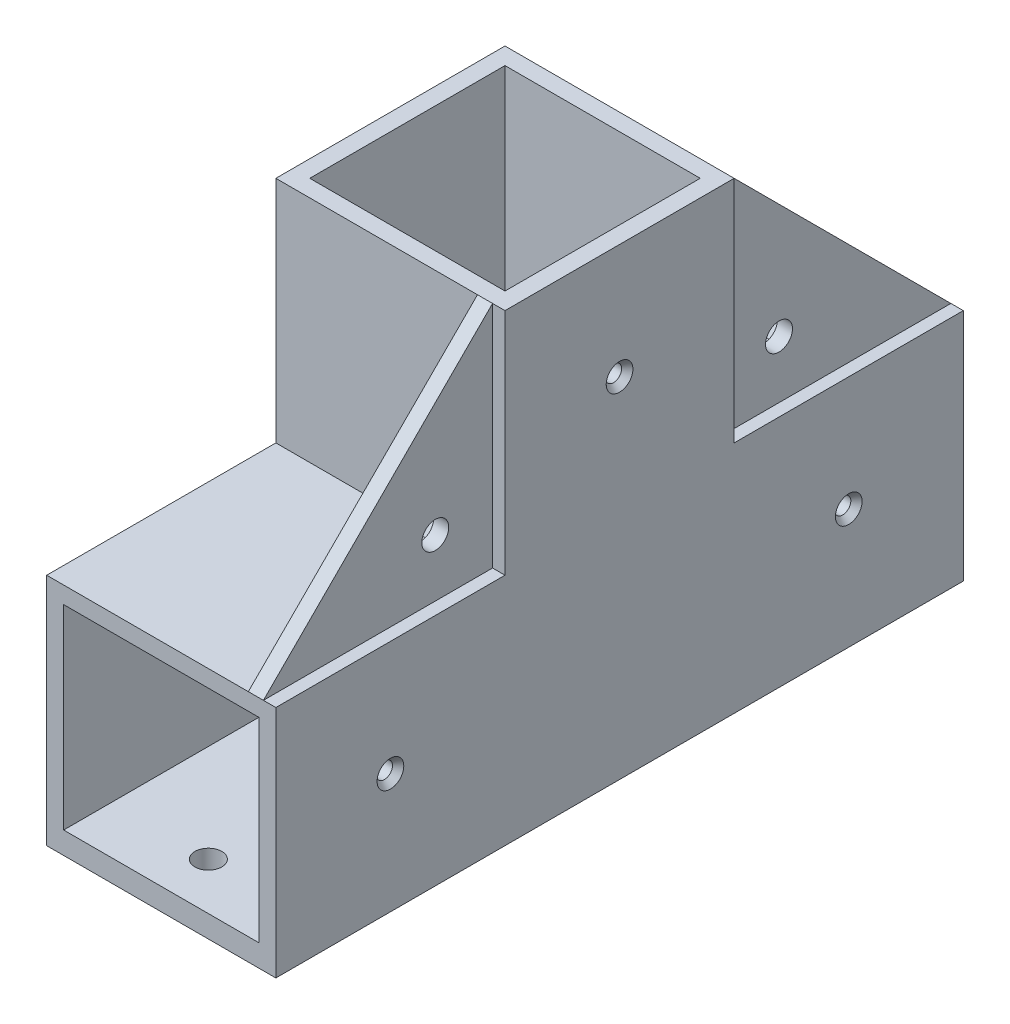
from build123d import *
from build123d.topology import SkipClean

# Parameters (mm, degrees)
ESQUISSE1_W                                       = 60.8
ESQUISSE1_H                                       = 121.6
BOSS_EXTRU_1_DEPTH                                = 91.2
ESQUISSE2_W                                       = 60.8
ESQUISSE2_H                                       = 60.8
ENL_V_MAT_EXTRU_1_DEPTH                           = 126.342411019
ESQUISSE3_W                                       = 51.8
ESQUISSE3_H                                       = 51.8
ENL_V_MAT_EXTRU_2_DEPTH                           = 60.8
BOSS_EXTRU_3_DEPTH                                = 4
ESQUISSE6_W                                       = 51.8
ESQUISSE6_H                                       = 51.8
ENL_V_MAT_EXTRU_3_DEPTH                           = 60.8
D_GAGEMENT_1_43_D                                 = 7.14248
FRAISAGE_POUR_VIS_T_TE_FRAIS_E_BOMB_E_D           = 4.3053
FRAISAGE_POUR_VIS_T_TE_FRAIS_E_BOMB_E_DEPTH       = 4.5
FRAISAGE_POUR_VIS_T_TE_FRAIS_E_BOMB_E_CSINK_D     = 7.0866
FRAISAGE_POUR_VIS_T_TE_FRAIS_E_BOMB_E_CSINK_ANGLE = 82
D_GAGEMENT_1_42_D                                 = 7.14248
D_GAGEMENT_1_42_DEPTH                             = 20
BOSS_EXTRU_5_DEPTH                                = 4
CHANFREIN1_SIZE                                   = 4
ESQUISSE26_W                                      = 60.8
ESQUISSE26_H                                      = 182.4
ESQUISSE26_R                                      = 3.57124
BOSS_EXTRU_7_DEPTH                                = 1.35


with BuildPart() as part:
    # Esquisse1 → Boss.-Extru.1 (new, symmetric)
    with BuildSketch(Plane.XY):
        Rectangle(ESQUISSE1_W, ESQUISSE1_H)
    extrude(amount=BOSS_EXTRU_1_DEPTH, both=True)

    # Esquisse2 → Enlèv. mat.-Extru.1 (cut, through all)
    with BuildSketch(Plane.ZY.offset(30.4)):
        with Locations((-60.8, 30.4)):
            Rectangle(ESQUISSE2_W, ESQUISSE2_H)
    enl_v_mat_extru_1 = extrude(amount=-ENL_V_MAT_EXTRU_1_DEPTH, mode=Mode.SUBTRACT)

    # Esquisse3 → Enlèv. mat.-Extru.2 (cut)
    with BuildSketch(Plane(origin=(0, 0, -91.2), x_dir=(-1, 0, 0), z_dir=(0, 0, -1))):
        with Locations((0, -30.4)):
            Rectangle(ESQUISSE3_W, ESQUISSE3_H)
    enl_v_mat_extru_2 = extrude(amount=-ENL_V_MAT_EXTRU_2_DEPTH, mode=Mode.SUBTRACT)

    # Symétrie2: Enlèv. mat.-Extru.1, Enlèv. mat.-Extru.2 across plane
    add(enl_v_mat_extru_1.mirror(Plane.XY), mode=Mode.SUBTRACT)
    add(enl_v_mat_extru_2.mirror(Plane.XY), mode=Mode.SUBTRACT)

    # Esquisse10 → Boss.-Extru.3 (add)
    with BuildSketch(Plane(origin=(27.1, 0, 0), x_dir=(0, 0, -1), z_dir=(1, 0, 0))):
        Polygon((30.4, 60.8), (30.4, 0), (91.2, 0), align=None)
        Polygon((-30.4, 60.8), (-91.2, 0), (-30.4, 0), align=None)
    extrude(amount=-BOSS_EXTRU_3_DEPTH)

    # Esquisse6 → Enlèv. mat.-Extru.3 (cut)
    with BuildSketch(Plane(origin=(0, 60.8, 0), x_dir=(1, 0, 0), z_dir=(0, 1, 0))):
        Rectangle(ESQUISSE6_W, ESQUISSE6_H)
    extrude(amount=-ENL_V_MAT_EXTRU_3_DEPTH, mode=Mode.SUBTRACT)

    # Dégagement 1/43 (through all)
    with Locations(Plane(origin=(27.1, 0, 0), x_dir=(0, 0, -1), z_dir=(1, 0, 0))):
        with Locations((45.6, 15.2), (-45.6, 15.2)):
            Hole(D_GAGEMENT_1_43_D / 2)

    # Fraisage pour vis _ t_te frais_e bomb_e
    with Locations(Plane(origin=(30.4, 0, 0), x_dir=(0, 0, -1), z_dir=(1, 0, 0))):
        with Locations((-60.8, -30.4), (0, 30.4), (60.8, -30.4)):
            CounterSinkHole(FRAISAGE_POUR_VIS_T_TE_FRAIS_E_BOMB_E_D / 2, FRAISAGE_POUR_VIS_T_TE_FRAIS_E_BOMB_E_CSINK_D / 2, depth=FRAISAGE_POUR_VIS_T_TE_FRAIS_E_BOMB_E_DEPTH, counter_sink_angle=FRAISAGE_POUR_VIS_T_TE_FRAIS_E_BOMB_E_CSINK_ANGLE)

    # Dégagement 1/42
    with Locations(Plane(origin=(0, -60.8, 0), x_dir=(-1, 0, 0), z_dir=(0, -1, 0))):
        with Locations((0, 78.7), (0, -78.7)):
            Hole(D_GAGEMENT_1_42_D / 2, depth=D_GAGEMENT_1_42_DEPTH)

    # Esquisse23 → Boss.-Extru.5 (add)
    # profile 1 of 2: a face of its own
    with BuildSketch(Plane.ZY.offset(-23.1)):
        Polygon((-41.197704197, 22.825), (-50.002295803, 22.825), (-54.404591605, 15.2), (-50.002295803, 7.575), (-41.197704197, 7.575), (-36.795408395, 15.2), align=None)
        Polygon((-40.25951001, 15.2), (-42.929755005, 19.825), (-48.270244995, 19.825), (-50.94048999, 15.2), (-48.270244995, 10.575), (-42.929755005, 10.575), align=None, mode=Mode.SUBTRACT)
    # profile 2 of 2: a face of its own
    with BuildSketch(Plane.ZY.offset(-23.1)):
        Polygon((54.404591605, 15.2), (50.002295803, 22.825), (41.197704197, 22.825), (36.795408395, 15.2), (41.197704197, 7.575), (50.002295803, 7.575), align=None)
        Polygon((50.94048999, 15.2), (48.270244995, 19.825), (42.929755005, 19.825), (40.25951001, 15.2), (42.929755005, 10.575), (48.270244995, 10.575), align=None, mode=Mode.SUBTRACT)
    extrude(amount=BOSS_EXTRU_5_DEPTH)

    # Chanfrein1
    chanfrein1_edges = [part.edges().sort_by_distance(p)[0] for p in [
        (23.1, 19.0125, 38.996556296),
        (23.1, 11.3875, 38.996556296),
        (23.1, 7.575, 45.6),
        (23.1, 11.3875, 52.203443704),
        (23.1, 19.0125, 52.203443704),
        (23.1, 22.825, 45.6),
        (23.1, 11.3875, -38.996556296),
        (23.1, 19.0125, -38.996556296),
        (23.1, 7.575, -45.6),
        (23.1, 11.3875, -52.203443704),
        (23.1, 22.825, -45.6),
        (23.1, 19.0125, -52.203443704),
    ]]
    chamfer(chanfrein1_edges, length=CHANFREIN1_SIZE - 0.0001)  # a hair under: the kernel refuses the full size

    # Esquisse26 → Boss.-Extru.7 (add)
    with SkipClean():  # the faces are left unmerged after this step: merging them gives an invalid solid
        with BuildSketch(Plane.XZ.offset(60.8)):
            Rectangle(ESQUISSE26_W, ESQUISSE26_H)
            with Locations(Location((0, 78.7, 0), (0, 0, 270))):
                Circle(ESQUISSE26_R, mode=Mode.SUBTRACT)
            with Locations(Location((0, -78.7, 0), (0, 0, 270))):
                Circle(ESQUISSE26_R, mode=Mode.SUBTRACT)
        extrude(amount=BOSS_EXTRU_7_DEPTH)
    add(part.part.scale(1), mode=Mode.REPLACE)  # the faces are merged on a copy


solid = part.part
